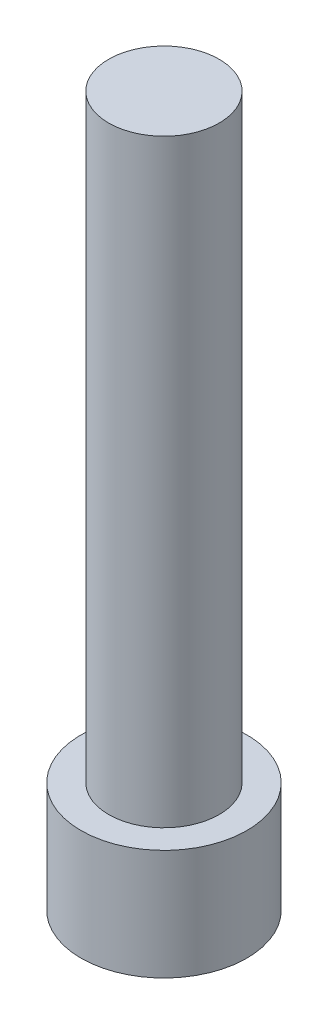
from build123d import *

# Parameters (mm, degrees)
SKETCH1_R           = 9
BOSS_EXTRUDE1_DEPTH = 12
SKETCH2_R           = 6
BOSS_EXTRUDE2_DEPTH = 65


with BuildPart() as part:
    # Sketch1 → Boss-Extrude1 (new body)
    with BuildSketch(Plane(origin=(0, 0, 0), x_dir=(1, 0, 0), z_dir=(0, 1, 0))):
        Circle(SKETCH1_R)
    extrude(amount=BOSS_EXTRUDE1_DEPTH)

    # Sketch2 → Boss-Extrude2 (add)
    with BuildSketch(Plane(origin=(0, 12, 0), x_dir=(1, 0, 0), z_dir=(0, 1, 0))):
        Circle(SKETCH2_R)
    extrude(amount=BOSS_EXTRUDE2_DEPTH)


solid = part.part
